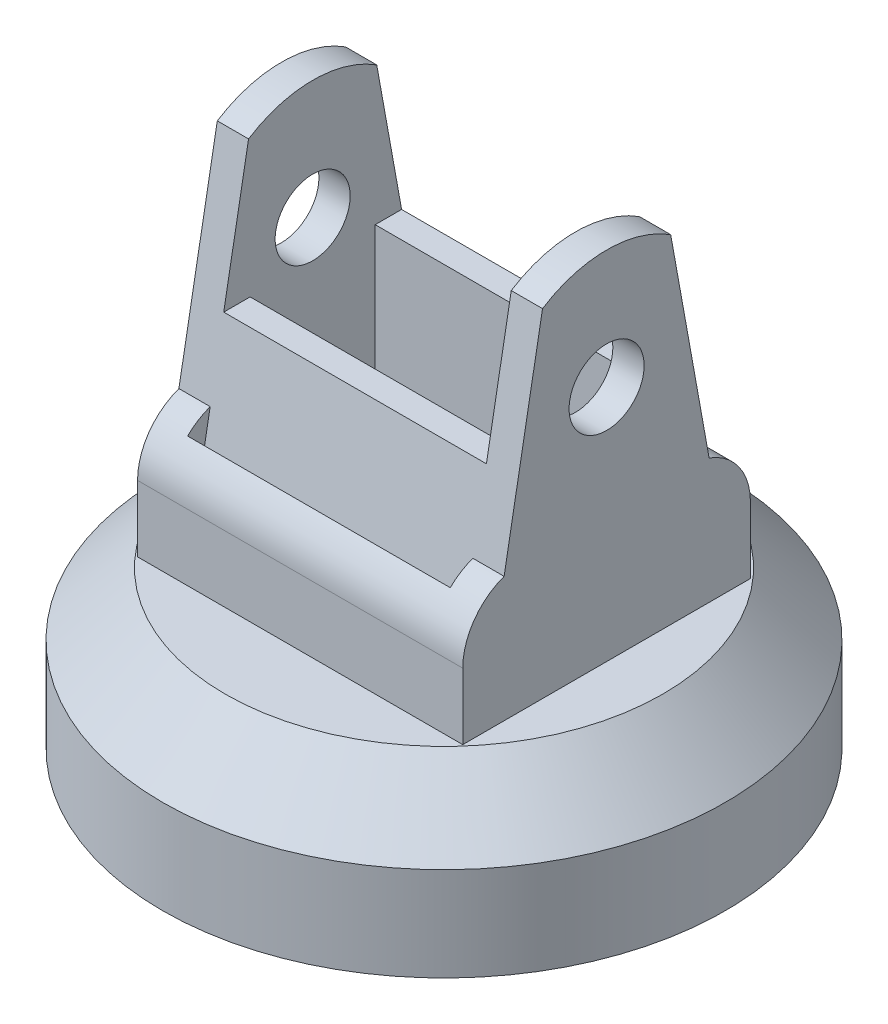
from build123d import *

# Parameters (mm, degrees)
SKETCH1_R               = 45
SKETCH1_R_2             = 40
BOSS_EXTRUDE1_DEPTH     = 10
BOSS_EXTRUDE2_START     = -15
SKETCH2_R               = 45
BOSS_EXTRUDE2_DEPTH     = 15
CHAMFER1_SIZE           = 10
CUT_EXTRUDE1_REACH      = 71.842
CUT_EXTRUDE1_END_RADIUS = 45
SKETCH4_R               = 2
SKETCH9_R               = 6
BOSS_EXTRUDE4_DEPTH     = 5
BOSS_EXTRUDE5_DEPTH     = 42
CUT_EXTRUDE2_REACH      = 87.434
BOSS_EXTRUDE6_DEPTH     = 5
SKETCH14_W              = 3
SKETCH14_H              = 20
BOSS_EXTRUDE7_DEPTH     = 42
FILLET1_START           = -27
FILLET1_DEPTH           = 54
FILLET2_START           = -27
FILLET2_DEPTH           = 54


with BuildPart() as part:
    # Sketch1 → Boss-Extrude1 (new body)
    with BuildSketch(Plane(origin=(0, 0, 0), x_dir=(1, 0, 0), z_dir=(0, 1, 0))):
        with Locations(Location((0, 0, 0), (0, 0, 270))):
            Circle(SKETCH1_R)
        with Locations(Location((0, 0, 0), (0, 0, 270))):
            Circle(SKETCH1_R_2, mode=Mode.SUBTRACT)
    extrude(amount=BOSS_EXTRUDE1_DEPTH)

    # Sketch2 → Boss-Extrude2 (add)
    with BuildSketch(Plane(origin=(0, 25, 0), x_dir=(1, 0, 0), z_dir=(0, 1, 0)).offset(BOSS_EXTRUDE2_START)):
        with Locations(Location((0, 0, 0), (0, 0, 270))):
            Circle(SKETCH2_R)
        with BuildLine():
            Line((-2.323790008, 2.2), (2.323790008, 2.2))
            ThreePointArc((2.323790008, 2.2), (0, -3.2), (-2.323790008, 2.2))
        make_face(mode=Mode.SUBTRACT)
    extrude(amount=BOSS_EXTRUDE2_DEPTH)

    # Chamfer1
    chamfer1_edges = [part.edges().sort_by_distance(p)[0] for p in [
        (0, 25, -45),
    ]]
    chamfer(chamfer1_edges, length=CHAMFER1_SIZE)

    # Cut-Extrude1: up to this cylinder (the profile starts inside it)
    cut_extrude1_end = Plane(origin=(0, 12.354135, 0), z_dir=(0, -1, 0)) * Cylinder(CUT_EXTRUDE1_END_RADIUS, 234.684, mode=Mode.PRIVATE)
    # Sketch4 → Cut-Extrude1 (cut, up to the surface)
    with BuildSketch(Plane.XY.offset(-2.2), mode=Mode.PRIVATE) as cut_extrude1_sk1:
        with Locations((0, 12.354134675)):
            Circle(SKETCH4_R)
    cut_extrude1_tool1 = extrude(cut_extrude1_sk1.sketch, amount=-CUT_EXTRUDE1_REACH, mode=Mode.PRIVATE) & cut_extrude1_end
    add(cut_extrude1_tool1.solids().sort_by_distance((0, 12.354135, -2.2))[0], mode=Mode.SUBTRACT)

    # Sketch9 → Boss-Extrude4 (add)
    with BuildSketch(Plane(origin=(21, 0, 0), x_dir=(0, 0, -1), z_dir=(1, 0, 0))):
        with BuildLine():
            Line((20, 25), (-20, 25))
            Line((-20, 25), (-10.246950766, 79))
            ThreePointArc((-10.246950766, 79), (0, 82), (10.246950766, 79))
            Line((10.246950766, 79), (20, 25))
        make_face()
        with Locations((0, 63)):
            Circle(SKETCH9_R, mode=Mode.SUBTRACT)
    boss_extrude4 = extrude(amount=BOSS_EXTRUDE4_DEPTH)

    # Mirror2: Boss-Extrude4 across plane
    add(boss_extrude4.mirror(Plane(origin=(0, 0, 0), x_dir=(0, 0, 1), z_dir=(1, 0, 0))))

    # Sketch10 → Boss-Extrude5 (add)
    with BuildSketch(Plane.ZY.offset(-21)):
        Polygon((-10, 57), (-14.220415269, 57), (-17.832655726, 37), (-10, 37), (-10, 52), align=None)
        Polygon((10, 52), (10, 57), (14.220415269, 57), (17.832655726, 37), (10, 37), align=None)
    extrude(amount=BOSS_EXTRUDE5_DEPTH)

    # Sketch11 → Cut-Extrude2 (cut, up to next)
    with BuildSketch(Plane(origin=(0, 25, 0), x_dir=(1, 0, 0), z_dir=(0, 1, 0)), mode=Mode.PRIVATE) as cut_extrude2_sk1:
        Polygon((-21, -17.832655726), (-21, -20), (21, -20), (21, -15), (-21, -15), align=None)
    cut_extrude2_tool1 = extrude(cut_extrude2_sk1.sketch, amount=-CUT_EXTRUDE2_REACH, mode=Mode.PRIVATE) & part.part
    add(cut_extrude2_tool1.solids().sort_by_distance((0, 25, 17.5))[0], mode=Mode.SUBTRACT)

    # Sketch13 → Boss-Extrude6 (add)
    with BuildSketch(Plane.ZY.offset(26)):
        Polygon((20, 25), (16.387759543, 45), (20, 45), (23, 45), (23, 25), align=None)
        Polygon((-23, 25), (-20, 25), (-16.387759543, 45), (-20, 45), (-23, 45), align=None)
    boss_extrude6 = extrude(amount=-BOSS_EXTRUDE6_DEPTH)

    # Mirror3: Boss-Extrude6 across plane
    add(boss_extrude6.mirror(Plane(origin=(0, 0, 0), x_dir=(0, 0, 1), z_dir=(1, 0, 0))))

    # Sketch14 → Boss-Extrude7 (add)
    with BuildSketch(Plane(origin=(-21, 0, 0), x_dir=(0, 0, -1), z_dir=(1, 0, 0))):
        with Locations((-21.5, 35)):
            Rectangle(SKETCH14_W, SKETCH14_H)
    boss_extrude7 = extrude(amount=BOSS_EXTRUDE7_DEPTH)

    # Mirror4: Boss-Extrude7 across plane
    add(boss_extrude7.mirror(Plane.XY))

    # Fillet1: read off the stored shape, not the designer's step
    # Fillet1 outline → Fillet1 (cut)
    with BuildSketch(Plane.YZ.offset(FILLET1_START)):
        with BuildLine():
            Line((45, 23), (35.59132925, 23))
            ThreePointArc((35.59132925, 23), (41.341216404, 21.181613393), (45, 16.387759543))
            Line((45, 16.387759543), (45, 23))
        make_face()
    extrude(amount=FILLET1_DEPTH, mode=Mode.SUBTRACT)

    # Fillet2: read off the stored shape, not the designer's step
    # Fillet2 outline → Fillet2 (cut)
    with BuildSketch(Plane.YZ.offset(FILLET2_START)):
        with BuildLine():
            Line((35.59132925, -23), (45, -23))
            Line((45, -23), (45, -16.387759543))
            ThreePointArc((45, -16.387759543), (41.341216404, -21.181613393), (35.59132925, -23))
        make_face()
    extrude(amount=FILLET2_DEPTH, mode=Mode.SUBTRACT)


solid = part.part
